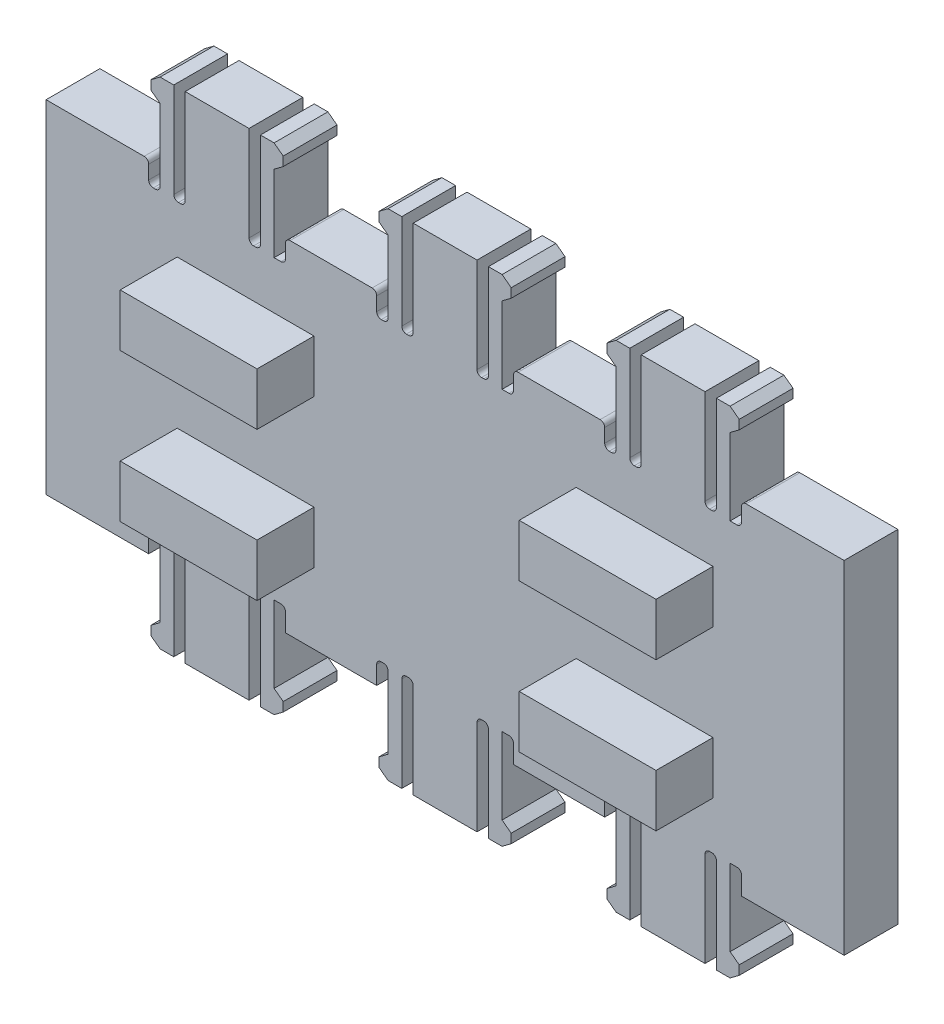
from build123d import *

# Parameters (mm, degrees)
SKETCH1_W                                    = 44.45
SKETCH1_H                                    = 19.05
BODY_DEPTH                                   = 2.9972
SKETCH2_W                                    = 6.35
SKETCH2_H                                    = 2.9972
TAB_DEPTH                                    = 4.2672
SKETCH3_W                                    = 0.635
SKETCH3_H                                    = 5.5372
SKETCH3_H_2                                  = 1.27
SLOTS_DEPTH                                  = 27.327905608
FILLET1_R                                    = 0.254
RETAINER_DEPTH                               = 2.9972
TAB_PATTERN_COUNT                            = 3
TAB_PATTERN_PITCH                            = 12.7
TAB_PATTERN_COPY_1_DEPTH                     = 2.9972
TAB_PATTERN_COPY_2_DEPTH                     = 2.9972
FILLET1_OF_TAB_PATTERN_R                     = 0.254
TAB_MIRROR_DEPTH                             = 2.9972
TAB_MIRROR_2_OUTLINE_W                       = 3.556
TAB_MIRROR_2_OUTLINE_H                       = 4.2672
TAB_MIRROR_2_DEPTH                           = 2.9972
SKETCH7_W                                    = 7.62
SKETCH7_H                                    = 2.921
BOSS_DEPTH                                   = 3.175
BOSS_MIRROR_AT_THE_SECOND_PLANE_COPY_1_S_W   = 7.62
BOSS_MIRROR_AT_THE_SECOND_PLANE_COPY_1_S_H   = 2.921
BOSS_MIRROR_AT_THE_SECOND_PLANE_COPY_1_DEPTH = 3.175


# Read off the part's stored shape, not the designer's step: Tab Mirror
with BuildPart() as part:
    # Sketch1 → Body (new body)
    with BuildSketch(Plane.XY):
        Rectangle(SKETCH1_W, SKETCH1_H)
    extrude(amount=BODY_DEPTH)

    # Sketch2 → Tab (add)
    with BuildSketch(Plane(origin=(0, 9.525, 0), x_dir=(1, 0, 0), z_dir=(0, 1, 0))):
        with Locations((-12.7, -1.4986)):
            Rectangle(SKETCH2_W, SKETCH2_H)
    tab = extrude(amount=TAB_DEPTH)

    # Sketch3 → Slots (cut, through all)
    with BuildSketch(Plane.XY.offset(2.9972)):
        with Locations((-14.7955, 11.0236)):
            Rectangle(SKETCH3_W, SKETCH3_H)
        with Locations((-10.6045, 11.0236)):
            Rectangle(SKETCH3_W, SKETCH3_H)
        with Locations((-9.2075, 8.89)):
            Rectangle(SKETCH3_W, SKETCH3_H_2)
        with Locations((-16.1925, 8.89)):
            Rectangle(SKETCH3_W, SKETCH3_H_2)
    slots = extrude(amount=-SLOTS_DEPTH, mode=Mode.SUBTRACT)

    # Fillet1
    fillet1_edges = [part.edges().sort_by_distance(p)[0] for p in [
        (-15.875, 8.255, 1.4986),
        (-16.51, 8.255, 1.4986),
        (-16.51, 9.525, 1.4986),
        (-8.89, 9.525, 1.4986),
        (-8.89, 8.255, 1.4986),
        (-10.287, 8.255, 1.4986),
        (-10.922, 8.255, 1.4986),
        (-14.478, 8.255, 1.4986),
        (-15.113, 8.255, 1.4986),
    ]]
    fillet(fillet1_edges, radius=FILLET1_R)

    # Sketch5 → Retainer (add)
    with BuildSketch(Plane.XY.offset(2.9972)):
        Polygon((-15.875, 13.7922), (-16.383, 13.4112), (-16.383, 12.9032), (-15.875, 12.5222), align=None)
    retainer = extrude(amount=-RETAINER_DEPTH)

    # Retainer Mirror: Retainer across plane
    add(retainer.mirror(Plane.ZY.offset(12.7)))

    # Tab Pattern: Tab, Slots, Retainer ×3
    with Locations(*[(i * TAB_PATTERN_PITCH, 0, 0) for i in range(1, TAB_PATTERN_COUNT)]):
        add(tab)
        add(slots, mode=Mode.SUBTRACT)
        add(retainer)

    # Tab Pattern copy 1 sketch → Tab Pattern copy 1 (add)
    with BuildSketch(Plane(origin=(-12.7, 0, 2.9972), x_dir=(-1, 0, 0), z_dir=(0, 0, 1))):
        Polygon((-15.875, -13.7922), (-16.383, -13.4112), (-16.383, -12.9032), (-15.875, -12.5222), align=None)
    extrude(amount=-TAB_PATTERN_COPY_1_DEPTH)

    # Tab Pattern copy 2 sketch → Tab Pattern copy 2 (add)
    with BuildSketch(Plane(origin=(0, 0, 2.9972), x_dir=(-1, 0, 0), z_dir=(0, 0, 1))):
        Polygon((-15.875, -13.7922), (-16.383, -13.4112), (-16.383, -12.9032), (-15.875, -12.5222), align=None)
    extrude(amount=-TAB_PATTERN_COPY_2_DEPTH)

    # Fillet1 of Tab Pattern
    fillet1_of_tab_pattern_edges = [part.edges().sort_by_distance(p)[0] for p in [
        (-3.175, 8.255, 1.4986),
        (-3.81, 8.255, 1.4986),
        (-3.81, 9.525, 1.4986),
        (3.81, 9.525, 1.4986),
        (3.81, 8.255, 1.4986),
        (2.413, 8.255, 1.4986),
        (1.778, 8.255, 1.4986),
        (-1.778, 8.255, 1.4986),
        (-2.413, 8.255, 1.4986),
        (9.525, 8.255, 1.4986),
        (8.89, 8.255, 1.4986),
        (8.89, 9.525, 1.4986),
        (16.51, 9.525, 1.4986),
        (16.51, 8.255, 1.4986),
        (15.113, 8.255, 1.4986),
        (14.478, 8.255, 1.4986),
        (10.922, 8.255, 1.4986),
        (10.287, 8.255, 1.4986),
    ]]
    fillet(fillet1_of_tab_pattern_edges, radius=FILLET1_OF_TAB_PATTERN_R)

    # Tab Mirror outline → Tab Mirror (cut)
    with BuildSketch(Plane.XY):
        with BuildLine():
            Line((15.875, -8.255), (15.875, -9.525))
            Line((15.875, -9.525), (16.51, -9.525))
            Line((16.51, -9.525), (16.51, -8.509))
            ThreePointArc((16.51, -8.509), (16.435605122, -8.329394878), (16.256, -8.255))
            Line((16.256, -8.255), (15.875, -8.255))
        make_face()
        with BuildLine():
            Line((14.478, -8.509), (14.478, -9.525))
            Line((14.478, -9.525), (15.113, -9.525))
            Line((15.113, -9.525), (15.113, -8.509))
            ThreePointArc((15.113, -8.509), (15.038605122, -8.329394878), (14.859, -8.255))
            Line((14.859, -8.255), (14.732, -8.255))
            ThreePointArc((14.732, -8.255), (14.552394878, -8.329394878), (14.478, -8.509))
        make_face()
        with BuildLine():
            Line((10.287, -8.509), (10.287, -9.525))
            Line((10.287, -9.525), (10.922, -9.525))
            Line((10.922, -9.525), (10.922, -8.509))
            ThreePointArc((10.922, -8.509), (10.847605122, -8.329394878), (10.668, -8.255))
            Line((10.668, -8.255), (10.541, -8.255))
            ThreePointArc((10.541, -8.255), (10.361394878, -8.329394878), (10.287, -8.509))
        make_face()
        with BuildLine():
            Line((-16.51, -9.525), (-15.875, -9.525))
            Line((-15.875, -9.525), (-15.875, -8.509))
            ThreePointArc((-15.875, -8.509), (-15.949394878, -8.329394878), (-16.129, -8.255))
            Line((-16.129, -8.255), (-16.256, -8.255))
            ThreePointArc((-16.256, -8.255), (-16.435605122, -8.329394878), (-16.51, -8.509))
            Line((-16.51, -8.509), (-16.51, -9.525))
        make_face()
        with BuildLine():
            Line((-15.113, -9.525), (-14.478, -9.525))
            Line((-14.478, -9.525), (-14.478, -8.509))
            ThreePointArc((-14.478, -8.509), (-14.552394878, -8.329394878), (-14.732, -8.255))
            Line((-14.732, -8.255), (-14.859, -8.255))
            ThreePointArc((-14.859, -8.255), (-15.038605122, -8.329394878), (-15.113, -8.509))
            Line((-15.113, -8.509), (-15.113, -9.525))
        make_face()
        with BuildLine():
            Line((-10.922, -9.525), (-10.287, -9.525))
            Line((-10.287, -9.525), (-10.287, -8.509))
            ThreePointArc((-10.287, -8.509), (-10.361394878, -8.329394878), (-10.541, -8.255))
            Line((-10.541, -8.255), (-10.668, -8.255))
            ThreePointArc((-10.668, -8.255), (-10.847605122, -8.329394878), (-10.922, -8.509))
            Line((-10.922, -8.509), (-10.922, -9.525))
        make_face()
        with BuildLine():
            Line((-9.525, -9.525), (-8.89, -9.525))
            Line((-8.89, -9.525), (-8.89, -8.509))
            ThreePointArc((-8.89, -8.509), (-8.964394878, -8.329394878), (-9.144, -8.255))
            Line((-9.144, -8.255), (-9.525, -8.255))
            Line((-9.525, -8.255), (-9.525, -9.525))
        make_face()
        with BuildLine():
            Line((-3.81, -9.525), (-3.175, -9.525))
            Line((-3.175, -9.525), (-3.175, -8.509))
            ThreePointArc((-3.175, -8.509), (-3.249394878, -8.329394878), (-3.429, -8.255))
            Line((-3.429, -8.255), (-3.556, -8.255))
            ThreePointArc((-3.556, -8.255), (-3.735605122, -8.329394878), (-3.81, -8.509))
            Line((-3.81, -8.509), (-3.81, -9.525))
        make_face()
        with BuildLine():
            Line((-2.413, -9.525), (-1.778, -9.525))
            Line((-1.778, -9.525), (-1.778, -8.509))
            ThreePointArc((-1.778, -8.509), (-1.852394878, -8.329394878), (-2.032, -8.255))
            Line((-2.032, -8.255), (-2.159, -8.255))
            ThreePointArc((-2.159, -8.255), (-2.338605122, -8.329394878), (-2.413, -8.509))
            Line((-2.413, -8.509), (-2.413, -9.525))
        make_face()
        with BuildLine():
            Line((1.778, -9.525), (2.413, -9.525))
            Line((2.413, -9.525), (2.413, -8.509))
            ThreePointArc((2.413, -8.509), (2.338605122, -8.329394878), (2.159, -8.255))
            Line((2.159, -8.255), (2.032, -8.255))
            ThreePointArc((2.032, -8.255), (1.852394878, -8.329394878), (1.778, -8.509))
            Line((1.778, -8.509), (1.778, -9.525))
        make_face()
        with BuildLine():
            Line((3.175, -9.525), (3.81, -9.525))
            Line((3.81, -9.525), (3.81, -8.509))
            ThreePointArc((3.81, -8.509), (3.735605122, -8.329394878), (3.556, -8.255))
            Line((3.556, -8.255), (3.175, -8.255))
            Line((3.175, -8.255), (3.175, -9.525))
        make_face()
        with BuildLine():
            Line((9.525, -9.525), (9.525, -8.509))
            ThreePointArc((9.525, -8.509), (9.450605122, -8.329394878), (9.271, -8.255))
            Line((9.271, -8.255), (9.144, -8.255))
            ThreePointArc((9.144, -8.255), (8.964394878, -8.329394878), (8.89, -8.509))
            Line((8.89, -8.509), (8.89, -9.525))
            Line((8.89, -9.525), (9.525, -9.525))
        make_face()
    extrude(amount=TAB_MIRROR_DEPTH, mode=Mode.SUBTRACT)

    # Tab Mirror 2 outline → Tab Mirror 2 (add)
    with BuildSketch(Plane.XY):
        Polygon((15.875, -9.525), (15.113, -9.525), (15.113, -13.7922), (15.875, -13.7922), (16.383, -13.4112), (16.383, -12.9032), (15.875, -12.5222), align=None)
        with Locations((12.7, -11.6586)):
            Rectangle(TAB_MIRROR_2_OUTLINE_W, TAB_MIRROR_2_OUTLINE_H)
        Polygon((10.287, -9.525), (9.525, -9.525), (9.525, -12.5222), (9.017, -12.9032), (9.017, -13.4112), (9.525, -13.7922), (10.287, -13.7922), align=None)
        Polygon((-15.113, -13.7922), (-15.113, -9.525), (-15.875, -9.525), (-15.875, -12.5222), (-16.383, -12.9032), (-16.383, -13.4112), (-15.875, -13.7922), align=None)
        with Locations((-12.7, -11.6586)):
            Rectangle(TAB_MIRROR_2_OUTLINE_W, TAB_MIRROR_2_OUTLINE_H)
        Polygon((-9.525, -12.5222), (-9.525, -9.525), (-10.287, -9.525), (-10.287, -13.7922), (-9.525, -13.7922), (-9.017, -13.4112), (-9.017, -12.9032), align=None)
        Polygon((-2.413, -13.7922), (-2.413, -9.525), (-3.175, -9.525), (-3.175, -12.5222), (-3.683, -12.9032), (-3.683, -13.4112), (-3.175, -13.7922), align=None)
        with Locations((0, -11.6586)):
            Rectangle(TAB_MIRROR_2_OUTLINE_W, TAB_MIRROR_2_OUTLINE_H)
        Polygon((3.175, -12.5222), (3.175, -9.525), (2.413, -9.525), (2.413, -13.7922), (3.175, -13.7922), (3.683, -13.4112), (3.683, -12.9032), align=None)
    extrude(amount=TAB_MIRROR_2_DEPTH)

    # Sketch7 → Boss (add)
    with BuildSketch(Plane.XY.offset(2.9972)):
        with Locations((-11.1125, 4.1275)):
            Rectangle(SKETCH7_W, SKETCH7_H)
    boss = extrude(amount=BOSS_DEPTH)

    # Boss Mirror: Boss across plane
    add(boss.mirror(Plane.ZX))

    # Boss Mirror at the second plane: Boss across plane
    add(boss.mirror(Plane.ZY))

    # Boss Mirror at the second plane copy 1 s → Boss Mirror at the second plane copy 1 (add)
    with BuildSketch(Plane(origin=(0, 0, 2.9972), x_dir=(-1, 0, 0), z_dir=(0, 0, 1))):
        with Locations((-11.1125, 4.1275)):
            Rectangle(BOSS_MIRROR_AT_THE_SECOND_PLANE_COPY_1_S_W, BOSS_MIRROR_AT_THE_SECOND_PLANE_COPY_1_S_H)
    extrude(amount=BOSS_MIRROR_AT_THE_SECOND_PLANE_COPY_1_DEPTH)


solid = part.part
